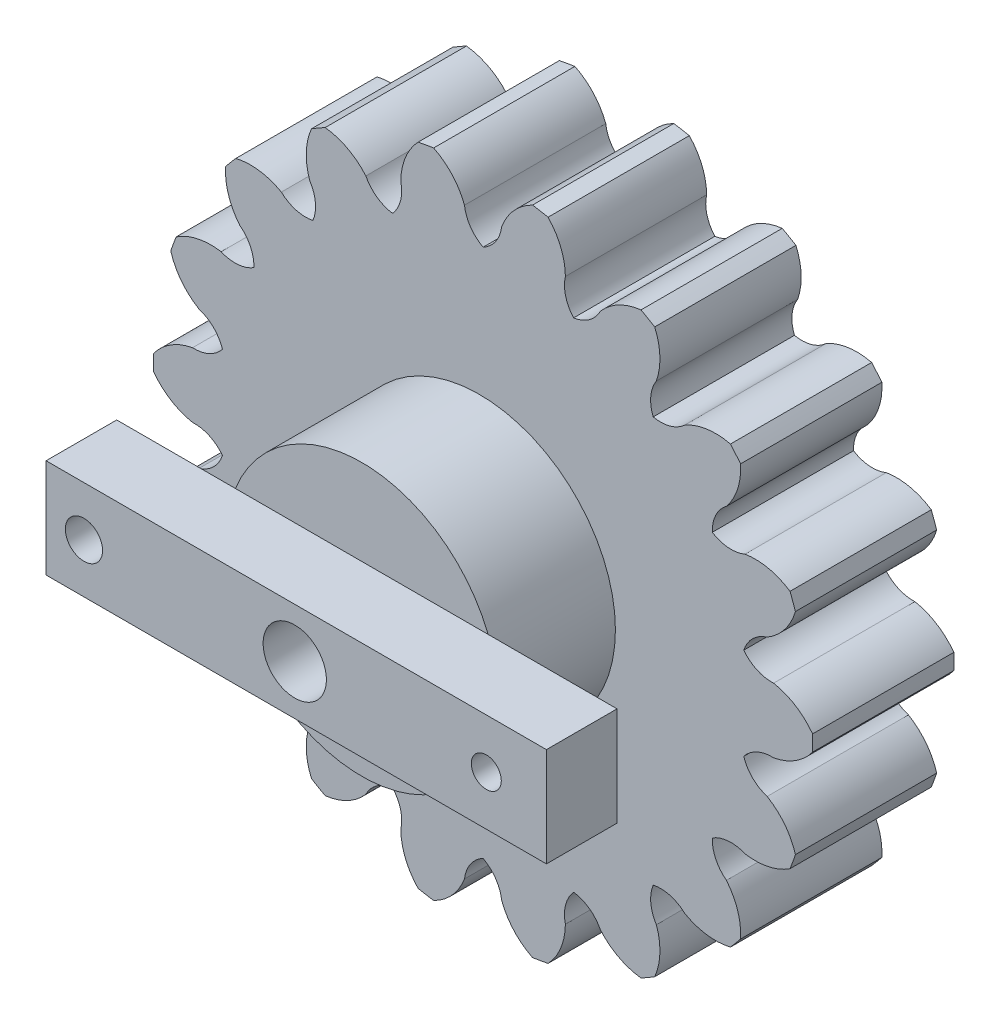
from build123d import *

# Parameters (mm, degrees)
SKETCH1_R           = 14
SKETCH1_R_2         = 1.5
BOSS_EXTRUDE1_DEPTH = 6
CUT_EXTRUDE1_DEPTH  = 6
CIRPATTERN2_COUNT   = 18
SKETCH3_R           = 5.774756077
SKETCH3_R_2         = 1.5
BOSS_EXTRUDE3_DEPTH = 5
SKETCH5_W           = 21.252901624
SKETCH5_H           = 4.204707469
SKETCH5_R           = 0.636470399
SKETCH5_R_2         = 1.34388398
SKETCH5_R_3         = 0.790704553
BOSS_EXTRUDE6_DEPTH = 3


with BuildPart() as part:
    # Sketch1 → Boss-Extrude1 (new body)
    with BuildSketch(Plane.XY):
        Circle(SKETCH1_R)
        Circle(SKETCH1_R_2, mode=Mode.SUBTRACT)
    extrude(amount=BOSS_EXTRUDE1_DEPTH)

    # Sketch2 → Cut-Extrude1 (cut)
    with BuildSketch(Plane.XY):
        with BuildLine():
            ThreePointArc((0, 11.241603953), (0.535784114, 11.719891388), (0.79, 12.391603953))
            ThreePointArc((0.79, 12.391603953), (1.307025272, 13.241256983), (2.1, 13.841603953))
            ThreePointArc((2.1, 13.841603953), (0, 14), (-2.1, 13.841603953))
            ThreePointArc((-2.1, 13.841603953), (-1.307025272, 13.241256983), (-0.79, 12.391603953))
            ThreePointArc((-0.79, 12.391603953), (-0.535784114, 11.719891388), (0, 11.241603953))
        make_face()
    cut_extrude1 = extrude(amount=CUT_EXTRUDE1_DEPTH, mode=Mode.SUBTRACT)

    # CirPattern2: Cut-Extrude1 ×18 about axis
    cirpattern2_axis = Axis((0, 0, 6), (0, 0, -1))
    for i in range(1, CIRPATTERN2_COUNT):
        add(cut_extrude1.rotate(cirpattern2_axis, i * 360 / CIRPATTERN2_COUNT), mode=Mode.SUBTRACT)

    # Sketch3 → Boss-Extrude3 (add)
    with BuildSketch(Plane.XY.offset(6)):
        with Locations((-0.153971115, -0.025789679)):
            Circle(SKETCH3_R)
        with Locations((-0.153971115, -0.025789679)):
            Circle(SKETCH3_R_2, mode=Mode.SUBTRACT)
    extrude(amount=BOSS_EXTRUDE3_DEPTH)

    # Sketch5 → Boss-Extrude6 (add)
    with BuildSketch(Plane.XY.offset(11)):
        with Locations((0.063522029, 0.002006341)):
            Rectangle(SKETCH5_W, SKETCH5_H)
        with Locations((8.136295681, 0)):
            Circle(SKETCH5_R, mode=Mode.SUBTRACT)
        Circle(SKETCH5_R_2, mode=Mode.SUBTRACT)
        with Locations((-8.953870334, 0)):
            Circle(SKETCH5_R_3, mode=Mode.SUBTRACT)
    extrude(amount=BOSS_EXTRUDE6_DEPTH)


solid = part.part
